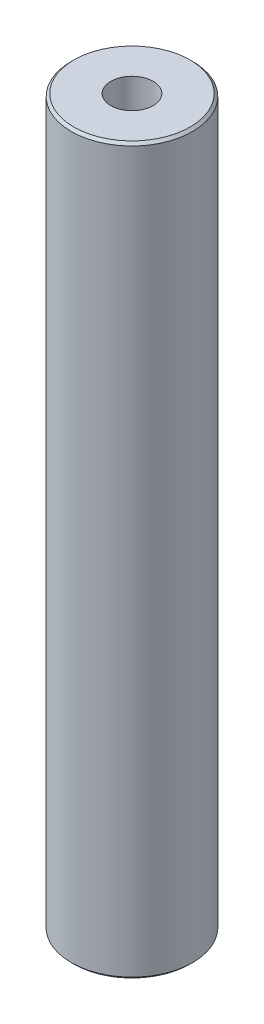
from build123d import *

# Parameters (mm, degrees)
SKETCH1_R           = 50
BOSS_EXTRUDE1_DEPTH = 596.94804633
SKETCH2_R           = 17.398374711
CUT_EXTRUDE1_DEPTH  = 602.121427016
CHAMFER1_SIZE       = 2.120776872


with BuildPart() as part:
    # Sketch1 → Boss-Extrude1 (new body)
    with BuildSketch(Plane(origin=(0, 0, 0), x_dir=(1, 0, 0), z_dir=(0, 1, 0))):
        Circle(SKETCH1_R)
    extrude(amount=BOSS_EXTRUDE1_DEPTH)

    # Sketch2 → Cut-Extrude1 (cut, through all)
    with BuildSketch(Plane(origin=(0, 0, 0), x_dir=(1, 0, 0), z_dir=(0, 1, 0))):
        Circle(SKETCH2_R)
    extrude(amount=CUT_EXTRUDE1_DEPTH, mode=Mode.SUBTRACT)

    # Chamfer1
    chamfer1_edges = [part.edges().sort_by_distance(p)[0] for p in [
        (-50, 596.94804633, 0),
        (-50, 0, 0),
    ]]
    chamfer(chamfer1_edges, length=CHAMFER1_SIZE)


solid = part.part
